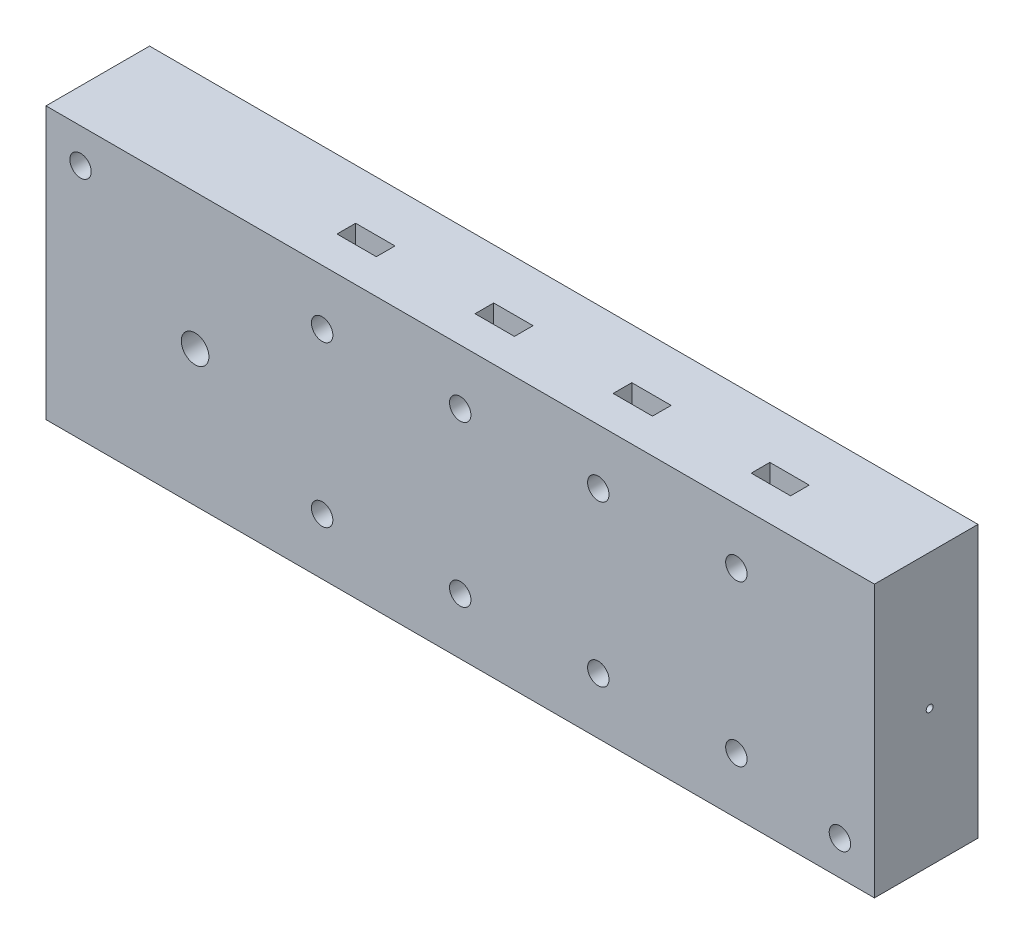
from build123d import *

# Parameters (mm, degrees)
SKIZZE2_W                        = 120
SKIZZE2_H                        = 39.364160046
AUFSATZ_LINEAR_AUSTRAGEN1_DEPTH  = 30
SKIZZE24_R                       = 1.55
SCHNITT_LINEAR_AUSTRAGEN4_DEPTH  = 130.805766806
SKIZZE46_R                       = 2.85
SCHNITT_LINEAR_AUSTRAGEN15_DEPTH = 10
SCHNITT_LINEAR_START             = -5
SCHNITT_LINEAR_AUSTRAGEN25_DEPTH = 2.7
LINEARES_MUSTER1_COUNT           = 4
LINEARES_MUSTER1_PITCH           = 20
SPIEGELN2_COPY_1_SKETCH_R        = 2.85
SPIEGELN2_COPY_1_DEPTH           = 10
SPIEGELN2_COPY_2_SKETCH_R        = 2.85
SPIEGELN2_COPY_2_DEPTH           = 10
SPIEGELN2_COPY_3_SKETCH_R        = 2.85
SPIEGELN2_COPY_3_DEPTH           = 10
SPIEGELN2_START                  = -5
SPIEGELN2_COPY_4_DEPTH           = 2.7
SPIEGELN2_COPY_5_DEPTH           = 2.7
SPIEGELN2_COPY_6_DEPTH           = 2.7
SKIZZE51_R                       = 1.55
SCHNITT_LINEAR_AUSTRAGEN26_DEPTH = 130.805766806
SKIZZE75_R                       = 0.75
SCHNITT_LINEAR_AUSTRAGEN28_DEPTH = 10
SKIZZE76_R                       = 2
SCHNITT_LINEAR_AUSTRAGEN29_DEPTH = 6
SKIZZE80_R                       = 0.5
SCHNITT_LINEAR_AUSTRAGEN34_DEPTH = 21
SCHNITT_LINEAR_START_2           = -7.5
SKIZZE81_R                       = 0.5
SCHNITT_LINEAR_AUSTRAGEN36_DEPTH = 5
ABSPALTEN3_OUTLINE_W             = 120
ABSPALTEN3_OUTLINE_H             = 39.364160046
ABSPALTEN3_OUTLINE_R             = 1.55
ABSPALTEN3_DEPTH                 = 15


# Read off the part's stored shape, not the designer's step: Abspalten3
with BuildPart() as part:
    # Skizze2 → Aufsatz-Linear austragen1 (new body)
    with BuildSketch(Plane.XY):
        with Locations((60, 19.682080023)):
            Rectangle(SKIZZE2_W, SKIZZE2_H)
    extrude(amount=AUFSATZ_LINEAR_AUSTRAGEN1_DEPTH)

    # Skizze24 → Schnitt-Linear austragen4 (cut, through all)
    with BuildSketch(Plane.XY.offset(30)):
        with Locations((40, 31.364160046)):
            Circle(SKIZZE24_R)
        with Locations((60, 31.364160046)):
            Circle(SKIZZE24_R)
        with Locations((80, 31.364160046)):
            Circle(SKIZZE24_R)
        with Locations((100, 31.364160046)):
            Circle(SKIZZE24_R)
    schnitt_linear_austragen4 = extrude(amount=-SCHNITT_LINEAR_AUSTRAGEN4_DEPTH, mode=Mode.SUBTRACT)

    # Skizze46 → Schnitt-Linear austragen15 (cut)
    with BuildSketch(Plane(origin=(0, 0, 0), x_dir=(-1, 0, 0), z_dir=(0, 0, -1))):
        with Locations((-100, 31.364160046)):
            Circle(SKIZZE46_R)
    schnitt_linear_austragen15 = extrude(amount=-SCHNITT_LINEAR_AUSTRAGEN15_DEPTH, mode=Mode.SUBTRACT)

    # Skizze50 → Schnitt-Linear austragen25 (cut)
    with BuildSketch(Plane.XY.offset(30).offset(SCHNITT_LINEAR_START)):
        Polygon((97.15, 33.009608314), (97.15, 39.364160046), (102.85, 39.364160046), (102.85, 33.009608314), (102.85, 29.718711779), (100, 28.073263512), (97.15, 29.718711779), align=None)
    schnitt_linear_austragen25 = extrude(amount=-SCHNITT_LINEAR_AUSTRAGEN25_DEPTH, mode=Mode.SUBTRACT)

    # Lineares Muster1: Schnitt-Linear austragen15, Schnitt-Linear austragen25 ×4
    with Locations(*[(-i * LINEARES_MUSTER1_PITCH, 0, 0) for i in range(1, LINEARES_MUSTER1_COUNT)]):
        add(schnitt_linear_austragen15, mode=Mode.SUBTRACT)
        add(schnitt_linear_austragen25, mode=Mode.SUBTRACT)

    # Spiegeln2: Schnitt-Linear austragen15, Schnitt-Linear austragen25 across plane
    add(schnitt_linear_austragen15.mirror(Plane.ZX.offset(19.764160046)), mode=Mode.SUBTRACT)
    add(schnitt_linear_austragen25.mirror(Plane.ZX.offset(19.764160046)), mode=Mode.SUBTRACT)

    # Spiegeln2 copy 1 sketch → Spiegeln2 copy 1 (cut)
    with BuildSketch(Plane(origin=(-20, 39.528320093, 0), x_dir=(-1, 0, 0), z_dir=(0, 0, -1))):
        with Locations((-100, -31.364160046)):
            Circle(SPIEGELN2_COPY_1_SKETCH_R)
    extrude(amount=-SPIEGELN2_COPY_1_DEPTH, mode=Mode.SUBTRACT)

    # Spiegeln2 copy 2 sketch → Spiegeln2 copy 2 (cut)
    with BuildSketch(Plane(origin=(-40, 39.528320093, 0), x_dir=(-1, 0, 0), z_dir=(0, 0, -1))):
        with Locations((-100, -31.364160046)):
            Circle(SPIEGELN2_COPY_2_SKETCH_R)
    extrude(amount=-SPIEGELN2_COPY_2_DEPTH, mode=Mode.SUBTRACT)

    # Spiegeln2 copy 3 sketch → Spiegeln2 copy 3 (cut)
    with BuildSketch(Plane(origin=(-60, 39.528320093, 0), x_dir=(-1, 0, 0), z_dir=(0, 0, -1))):
        with Locations((-100, -31.364160046)):
            Circle(SPIEGELN2_COPY_3_SKETCH_R)
    extrude(amount=-SPIEGELN2_COPY_3_DEPTH, mode=Mode.SUBTRACT)

    # Spiegeln2 copy 4 sketch → Spiegeln2 copy 4 (cut)
    with BuildSketch(Plane(origin=(-20, 39.528320093, 30), x_dir=(1, 0, 0), z_dir=(0, 0, 1)).offset(SPIEGELN2_START)):
        Polygon((97.15, -33.009608314), (97.15, -39.364160046), (102.85, -39.364160046), (102.85, -33.009608314), (102.85, -29.718711779), (100, -28.073263512), (97.15, -29.718711779), align=None)
    extrude(amount=-SPIEGELN2_COPY_4_DEPTH, mode=Mode.SUBTRACT)

    # Spiegeln2 copy 5 sketch → Spiegeln2 copy 5 (cut)
    with BuildSketch(Plane(origin=(-40, 39.528320093, 30), x_dir=(1, 0, 0), z_dir=(0, 0, 1)).offset(SPIEGELN2_START)):
        Polygon((97.15, -33.009608314), (97.15, -39.364160046), (102.85, -39.364160046), (102.85, -33.009608314), (102.85, -29.718711779), (100, -28.073263512), (97.15, -29.718711779), align=None)
    extrude(amount=-SPIEGELN2_COPY_5_DEPTH, mode=Mode.SUBTRACT)

    # Spiegeln2 copy 6 sketch → Spiegeln2 copy 6 (cut)
    with BuildSketch(Plane(origin=(-60, 39.528320093, 30), x_dir=(1, 0, 0), z_dir=(0, 0, 1)).offset(SPIEGELN2_START)):
        Polygon((97.15, -33.009608314), (97.15, -39.364160046), (102.85, -39.364160046), (102.85, -33.009608314), (102.85, -29.718711779), (100, -28.073263512), (97.15, -29.718711779), align=None)
    extrude(amount=-SPIEGELN2_COPY_6_DEPTH, mode=Mode.SUBTRACT)

    # Spiegeln3: Schnitt-Linear austragen4 across plane
    add(schnitt_linear_austragen4.mirror(Plane.ZX.offset(19.764160046)), mode=Mode.SUBTRACT)

    # Skizze51 → Schnitt-Linear austragen26 (cut, through all)
    with BuildSketch(Plane.XY.offset(30)):
        with Locations((5, 34.364160046)):
            Circle(SKIZZE51_R)
        with Locations((115, 5)):
            Circle(SKIZZE51_R)
    extrude(amount=-SCHNITT_LINEAR_AUSTRAGEN26_DEPTH, mode=Mode.SUBTRACT)

    # Skizze73 → Schnitt-Rotation5 (revolve, cut)
    with BuildSketch(Plane.XY.offset(15)):
        Polygon((15, 19.764160046), (15, 23.264160046), (20, 23.264160046), (20, 24.264160046), (100, 22.682080023), (100, 21.682080023), (105, 21.682080023), (105, 19.682080023), align=None)
    revolve(axis=Axis((105, 19.682080023, 15), (-0.9999995841280241, 0.0009119998787298228, 0)), mode=Mode.SUBTRACT)

    # Skizze75 → Schnitt-Linear austragen28 (cut)
    with BuildSketch(Plane.XY.offset(30)):
        with Locations((21.598259807, 19.682080023)):
            Circle(SKIZZE75_R)
    extrude(amount=-SCHNITT_LINEAR_AUSTRAGEN28_DEPTH, mode=Mode.SUBTRACT)

    # Skizze76 → Schnitt-Linear austragen29 (cut)
    with BuildSketch(Plane.XY.offset(30)):
        with Locations((21.598259807, 19.682080023)):
            Circle(SKIZZE76_R)
    extrude(amount=-SCHNITT_LINEAR_AUSTRAGEN29_DEPTH, mode=Mode.SUBTRACT)

    # Skizze80 → Schnitt-Linear austragen34 (cut)
    with BuildSketch(Plane(origin=(120, 0, 0), x_dir=(0, 0, -1), z_dir=(1, 0, 0))):
        with Locations((-22.000416524, 19.763714623)):
            Circle(SKIZZE80_R)
    schnitt_linear_austragen34 = extrude(amount=-SCHNITT_LINEAR_AUSTRAGEN34_DEPTH, mode=Mode.SUBTRACT)

    # Skizze81 → Schnitt-Linear austragen36 (cut)
    with BuildSketch(Plane.XY.offset(30).offset(SCHNITT_LINEAR_START_2)):
        with Locations(Location((99, 19.682080023, 0), (0, 0, 7.034090001))):
            Circle(SKIZZE81_R)
    schnitt_linear_austragen36 = extrude(amount=-SCHNITT_LINEAR_AUSTRAGEN36_DEPTH, mode=Mode.SUBTRACT)

    # Spiegeln4: Schnitt-Linear austragen34, Schnitt-Linear austragen36 across plane
    add(schnitt_linear_austragen34.mirror(Plane.XY.offset(15)), mode=Mode.SUBTRACT)
    add(schnitt_linear_austragen36.mirror(Plane.XY.offset(15)), mode=Mode.SUBTRACT)

    # Abspalten3 outline → Abspalten3 (cut)
    with BuildSketch(Plane.XY):
        with Locations((60, 19.682080023)):
            Rectangle(ABSPALTEN3_OUTLINE_W, ABSPALTEN3_OUTLINE_H)
        with Locations((115, 5)):
            Circle(ABSPALTEN3_OUTLINE_R, mode=Mode.SUBTRACT)
        with Locations((5, 34.364160046)):
            Circle(ABSPALTEN3_OUTLINE_R, mode=Mode.SUBTRACT)
        with Locations((40, 8.164160046)):
            Circle(ABSPALTEN3_OUTLINE_R, mode=Mode.SUBTRACT)
        with Locations((60, 8.164160046)):
            Circle(ABSPALTEN3_OUTLINE_R, mode=Mode.SUBTRACT)
        with Locations((80, 8.164160046)):
            Circle(ABSPALTEN3_OUTLINE_R, mode=Mode.SUBTRACT)
        with Locations((100, 8.164160046)):
            Circle(ABSPALTEN3_OUTLINE_R, mode=Mode.SUBTRACT)
        with Locations((40, 31.364160046)):
            Circle(ABSPALTEN3_OUTLINE_R, mode=Mode.SUBTRACT)
        with Locations((100, 31.364160046)):
            Circle(ABSPALTEN3_OUTLINE_R, mode=Mode.SUBTRACT)
        with Locations((60, 31.364160046)):
            Circle(ABSPALTEN3_OUTLINE_R, mode=Mode.SUBTRACT)
        with Locations((80, 31.364160046)):
            Circle(ABSPALTEN3_OUTLINE_R, mode=Mode.SUBTRACT)
    extrude(amount=ABSPALTEN3_DEPTH, mode=Mode.SUBTRACT)


solid = part.part
